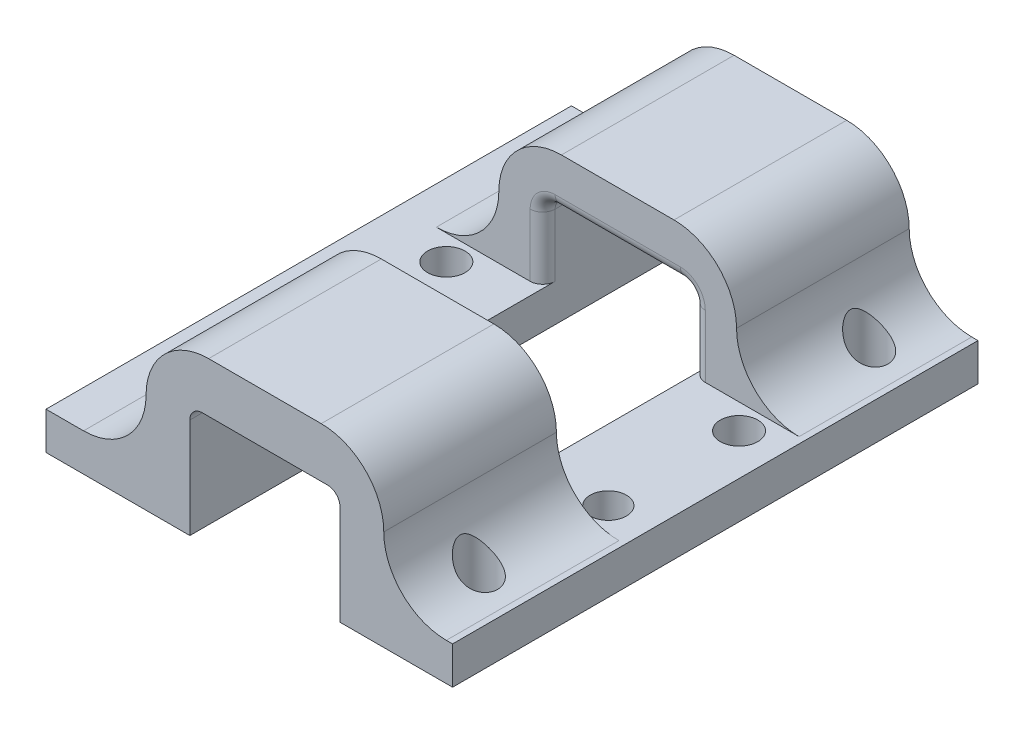
from build123d import *

# Parameters (mm, degrees)
SKETCH_2_W             = 32.5
SKETCH_2_H             = 42
SKETCH_2_R             = 1.5
SKETCH_2_R_2           = 1.449840903
EXTRUDE_1_DEPTH        = 3
SKETCH_4_W             = 12
SKETCH_4_H             = 42
CUT_EXTRUDE_1_DEPTH    = 22
EXTRUDE_2_DEPTH        = 42
FILLET_START           = 8
FILLET_1_OUTLINE_W     = 19
FILLET_1_OUTLINE_H     = 42
FILLET_1_DEPTH         = 5
FILLET_START_2         = -21
FILLET_1_2_DEPTH       = 42
FILLET_START_3         = 3
FILLET_1_3_OUTLINE_R   = 1.5
FILLET_1_3_OUTLINE_R_2 = 1.449840903
FILLET_1_3_DEPTH       = 5
CUT_EXTRUDE_2_REACH    = 31.565
SKETCH_6_W             = 36.57681216
SKETCH_6_H             = 14.4
FILLET_2_R             = 1


with BuildPart() as part:
    # Эскиз2 → Бобышка-Вытянуть1 (new body)
    with BuildSketch(Plane(origin=(0, 0, 0), x_dir=(1, 0, 0), z_dir=(0, 1, 0))):
        Rectangle(SKETCH_2_W, SKETCH_2_H)
        with Locations(Location((-10.45, -15.6, 0), (0, 0, 270))):
            Circle(SKETCH_2_R, mode=Mode.SUBTRACT)
        with Locations(Location((-10.45, -5.2, 0), (0, 0, 270))):
            Circle(SKETCH_2_R, mode=Mode.SUBTRACT)
        with Locations(Location((-10.45, 5.2, 0), (0, 0, 270))):
            Circle(SKETCH_2_R, mode=Mode.SUBTRACT)
        with Locations(Location((-10.45, 15.6, 0), (0, 0, 270))):
            Circle(SKETCH_2_R, mode=Mode.SUBTRACT)
        with Locations(Location((12.95, 15.6, 0), (0, 0, 270))):
            Circle(SKETCH_2_R, mode=Mode.SUBTRACT)
        with Locations(Location((12.95, 5.2, 0), (0, 0, 270))):
            Circle(SKETCH_2_R, mode=Mode.SUBTRACT)
        with Locations(Location((12.899840903, -5.2, 0), (0, 0, 270))):
            Circle(SKETCH_2_R_2, mode=Mode.SUBTRACT)
        with Locations(Location((12.95, -15.6, 0), (0, 0, 270))):
            Circle(SKETCH_2_R, mode=Mode.SUBTRACT)
    extrude(amount=EXTRUDE_1_DEPTH)

    # Эскиз4 → Вырез-Вытянуть1 (cut)
    with BuildSketch(Plane(origin=(0, 3, 0), x_dir=(1, 0, 0), z_dir=(0, 1, 0))):
        with Locations((1.25, 0)):
            Rectangle(SKETCH_4_W, SKETCH_4_H)
    extrude(amount=-CUT_EXTRUDE_1_DEPTH, mode=Mode.SUBTRACT)


with BuildPart() as cut_extrude_1_piece_1:
    # of the separate pieces the step leaves, piece 1, a body of its own (cut_extrude_1_pieces)
    add(part.part.solids().sort_by_distance((-16.25, 0, 21))[0])



with BuildPart() as cut_extrude_1_piece_2:
    # of the separate pieces the step leaves, piece 2, a body of its own (cut_extrude_1_pieces)
    add(part.part.solids().sort_by_distance((7.25, 0, 21))[0])


with BuildPart() as cut_extrude_1_piece_1_1:
    add(cut_extrude_1_piece_1.part)

    add(cut_extrude_1_piece_2.part)  # Бобышка-Вытянуть2 merges Вырез-Вытянуть1 piece 2
    # Эскиз5 → Бобышка-Вытянуть2 (add)
    with BuildSketch(Plane.XY.offset(21)):
        Polygon((-4.75, 0), (-4.75, 3), (-4.75, 9), (7.25, 9), (7.25, 3), (7.25, 0), (10.75, 0), (10.75, 13), (-8.25, 13), (-8.25, 0), align=None)
    extrude(amount=-EXTRUDE_2_DEPTH)

    # Скругление1: read off the stored shape, not the designer's step
    # Скругление1 outline → Скругление1 (cut)
    with BuildSketch(Plane(origin=(0, 0, 0), x_dir=(1, 0, 0), z_dir=(0, 1, 0)).offset(FILLET_START)):
        with Locations((1.25, 0)):
            Rectangle(FILLET_1_OUTLINE_W, FILLET_1_OUTLINE_H)
    extrude(amount=FILLET_1_DEPTH, mode=Mode.SUBTRACT)

    # Fillet 1 2 outline → Fillet 1 2 (add)
    with BuildSketch(Plane.XY.offset(FILLET_START_2)):
        with BuildLine():
            Line((-8.25, 3), (-8.25, 8))
            ThreePointArc((-8.25, 8), (-9.714466094, 4.464466094), (-13.25, 3))
            Line((-13.25, 3), (-8.25, 3))
        make_face()
        with BuildLine():
            ThreePointArc((15.75, 3), (12.214466094, 4.464466094), (10.75, 8))
            Line((10.75, 8), (10.75, 3))
            Line((10.75, 3), (15.75, 3))
        make_face()
        with BuildLine():
            Line((-4.75, 8), (-4.75, 9))
            Line((-4.75, 9), (7.25, 9))
            Line((7.25, 9), (7.25, 8))
            Line((7.25, 8), (10.75, 8))
            ThreePointArc((10.75, 8), (9.285533906, 11.535533906), (5.75, 13))
            Line((5.75, 13), (-3.25, 13))
            ThreePointArc((-3.25, 13), (-6.785533906, 11.535533906), (-8.25, 8))
            Line((-8.25, 8), (-4.75, 8))
        make_face()
    extrude(amount=FILLET_1_2_DEPTH)

    # Fillet 1 3 outline → Fillet 1 3 (cut)
    with BuildSketch(Plane(origin=(0, 0, 0), x_dir=(1, 0, 0), z_dir=(0, 1, 0)).offset(FILLET_START_3)):
        with Locations((-10.45, -15.6)):
            Circle(FILLET_1_3_OUTLINE_R)
        with Locations((-10.45, -5.2)):
            Circle(FILLET_1_3_OUTLINE_R)
        with Locations((-10.45, 5.2)):
            Circle(FILLET_1_3_OUTLINE_R)
        with Locations((-10.45, 15.6)):
            Circle(FILLET_1_3_OUTLINE_R)
        with Locations((12.899840903, -5.2)):
            Circle(FILLET_1_3_OUTLINE_R_2)
        with Locations((12.95, 15.6)):
            Circle(FILLET_1_3_OUTLINE_R)
        with Locations((12.95, 5.2)):
            Circle(FILLET_1_3_OUTLINE_R)
        with Locations((12.95, -15.6)):
            Circle(FILLET_1_3_OUTLINE_R)
    extrude(amount=FILLET_1_3_DEPTH, mode=Mode.SUBTRACT)

    # Вырез-Вытянуть2: up to this face of the body (flat: up to its plane)
    cut_extrude_2_end = Plane(cut_extrude_1_piece_1_1.part.faces().sort_by_distance((16, 3, 0))[0])
    # Эскиз6 → Вырез-Вытянуть2 (cut, up to the picked face)
    with BuildSketch(Plane(origin=(0, 13, 0), x_dir=(1, 0, 0), z_dir=(0, 1, 0)), mode=Mode.PRIVATE) as cut_extrude_2_sk1:
        Rectangle(SKETCH_6_W, SKETCH_6_H)
    cut_extrude_2_tool1 = split(extrude(cut_extrude_2_sk1.sketch, amount=-CUT_EXTRUDE_2_REACH, mode=Mode.PRIVATE), bisect_by=cut_extrude_2_end, keep=Keep.BOTH, mode=Mode.PRIVATE)
    add(cut_extrude_2_tool1.solids().sort_by(Axis((0, 13, 0), (0, -1, 0)))[0], mode=Mode.SUBTRACT)

    # Скругление2
    fillet_2_edges = [cut_extrude_1_piece_1_1.edges().sort_by_distance(p)[0] for p in [
        (7.25, 9, 14.1),
        (-4.75, 9, 14.1),
        (-4.75, 6, -7.2),
        (1.25, 9, -7.2),
        (7.25, 6, -7.2),
        (-4.75, 6, 7.2),
        (7.25, 6, 7.2),
        (1.25, 9, 7.2),
        (-4.75, 9, -14.1),
        (7.25, 9, -14.1),
    ]]
    fillet(fillet_2_edges, radius=FILLET_2_R)


solid = cut_extrude_1_piece_1_1.part
